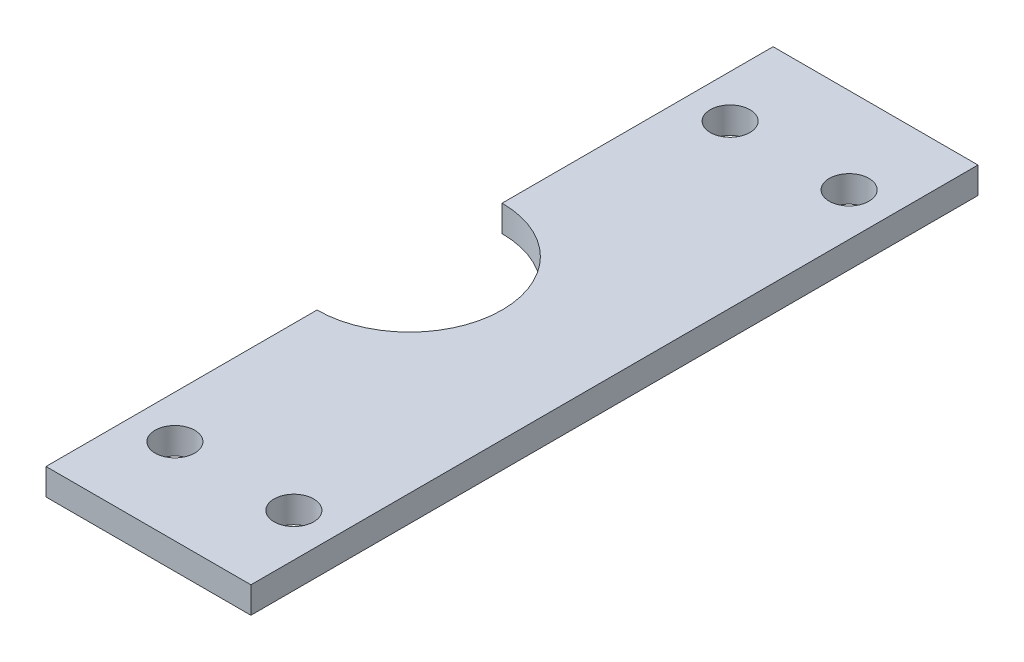
from build123d import *

# Parameters (mm, degrees)
ESQUISSE1_W             = 15.5
ESQUISSE1_H             = 2
EXTRU_MINCE1_DEPTH      = 55
ESQUISSE2_R             = 1.5
ESQUISSE2_R_2           = 7
ENL_V_MAT_EXTRU_1_DEPTH = 58.177355658


with BuildPart() as part:
    # Esquisse1 → Extru.-Mince1 (new body)
    with BuildSketch(Plane.XY):
        with Locations((7.75, 1)):
            Rectangle(ESQUISSE1_W, ESQUISSE1_H)
    extrude(amount=EXTRU_MINCE1_DEPTH)

    # Esquisse2 → Enlèv. mat.-Extru.1 (cut, through all)
    with BuildSketch(Plane(origin=(0, 2, 0), x_dir=(1, 0, 0), z_dir=(0, 1, 0))):
        with Locations((3.25, -6.5)):
            Circle(ESQUISSE2_R)
        with Locations((12.25, -6.5)):
            Circle(ESQUISSE2_R)
        with Locations((12.25, -48.5)):
            Circle(ESQUISSE2_R)
        with Locations((3.25, -48.5)):
            Circle(ESQUISSE2_R)
        with Locations((0, -27.5)):
            Circle(ESQUISSE2_R_2)
    extrude(amount=-ENL_V_MAT_EXTRU_1_DEPTH, mode=Mode.SUBTRACT)


solid = part.part
